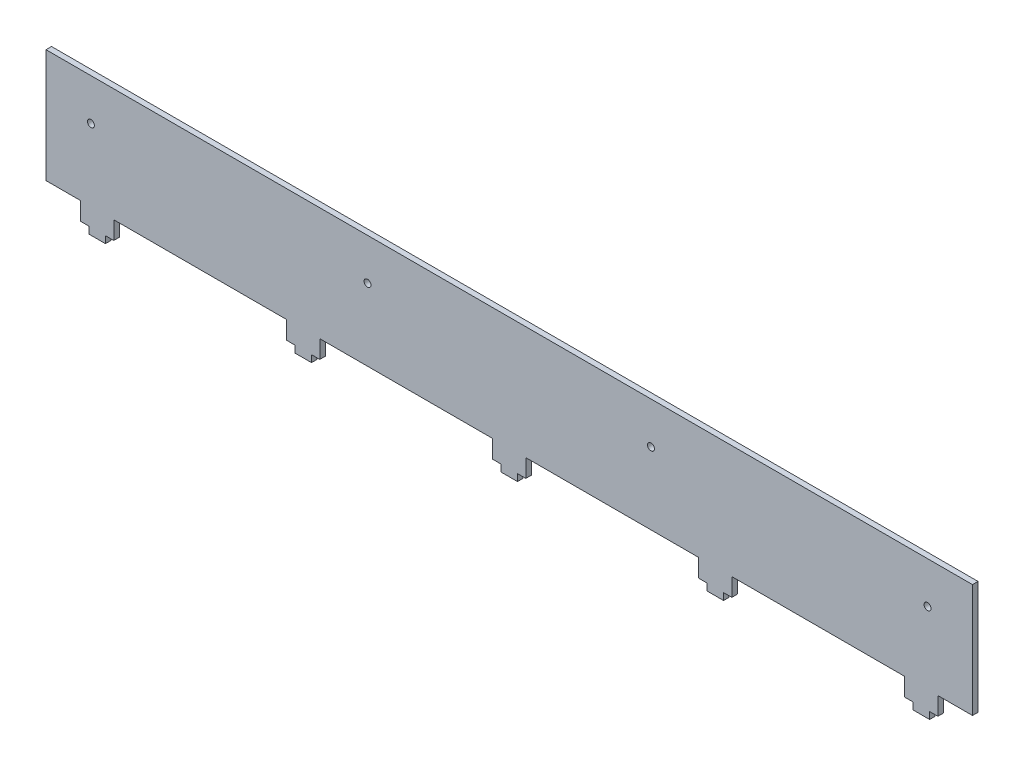
from build123d import *

# Parameters (mm, degrees)
SKETCH_1_W          = 670
SKETCH_1_H          = 95
EXTRUDE_1_DEPTH     = 2
SKETCH_2_W          = 125
SKETCH_2_H          = 13
CUT_EXTRUDE_1_DEPTH = 339.374422792
SKETCH_5_R          = 2.5
CUT_EXTRUDE_4_DEPTH = 339.374422792
SKETCH_6_W          = 12
SKETCH_6_H          = 4
EXTRUDE_2_DEPTH     = 5


with BuildPart() as part:
    # Эскиз1 → Бобышка-Вытянуть1 (new, symmetric)
    with BuildSketch(Plane.XY):
        Rectangle(SKETCH_1_W, SKETCH_1_H)
    extrude(amount=EXTRUDE_1_DEPTH, both=True)

    # Эскиз2 → Вырез-Вытянуть1 (cut, through all)
    with BuildSketch(Plane.XY.offset(2)):
        with Locations((-372.5, -41)):
            Rectangle(SKETCH_2_W, SKETCH_2_H)
        with Locations((-223.5, -41)):
            Rectangle(SKETCH_2_W, SKETCH_2_H)
        with Locations((-74.5, -41)):
            Rectangle(SKETCH_2_W, SKETCH_2_H)
        with Locations((74.5, -41)):
            Rectangle(SKETCH_2_W, SKETCH_2_H)
        with Locations((223.5, -41)):
            Rectangle(SKETCH_2_W, SKETCH_2_H)
        with Locations((372.5, -41)):
            Rectangle(SKETCH_2_W, SKETCH_2_H)
    extrude(amount=-CUT_EXTRUDE_1_DEPTH, mode=Mode.SUBTRACT)

    # Эскиз5 → Вырез-Вытянуть4 (cut, through all)
    with BuildSketch(Plane.XY.offset(2)):
        with Locations((-102.5, 17.5)):
            Circle(SKETCH_5_R)
        with Locations((102.5, 17.5)):
            Circle(SKETCH_5_R)
        with Locations((-302.5, 17.5)):
            Circle(SKETCH_5_R)
        with Locations((302.5, 17.5)):
            Circle(SKETCH_5_R)
    extrude(amount=-CUT_EXTRUDE_4_DEPTH, mode=Mode.SUBTRACT)

    # Эскиз6 → Бобышка-Вытянуть2 (add)
    with BuildSketch(Plane.XZ.offset(47.5)):
        with Locations((298, 0)):
            Rectangle(SKETCH_6_W, SKETCH_6_H)
        with Locations((149, 0)):
            Rectangle(SKETCH_6_W, SKETCH_6_H)
        Rectangle(SKETCH_6_W, SKETCH_6_H)
        with Locations((-149, 0)):
            Rectangle(SKETCH_6_W, SKETCH_6_H)
        with Locations((-298, 0)):
            Rectangle(SKETCH_6_W, SKETCH_6_H)
    extrude(amount=EXTRUDE_2_DEPTH)


solid = part.part
